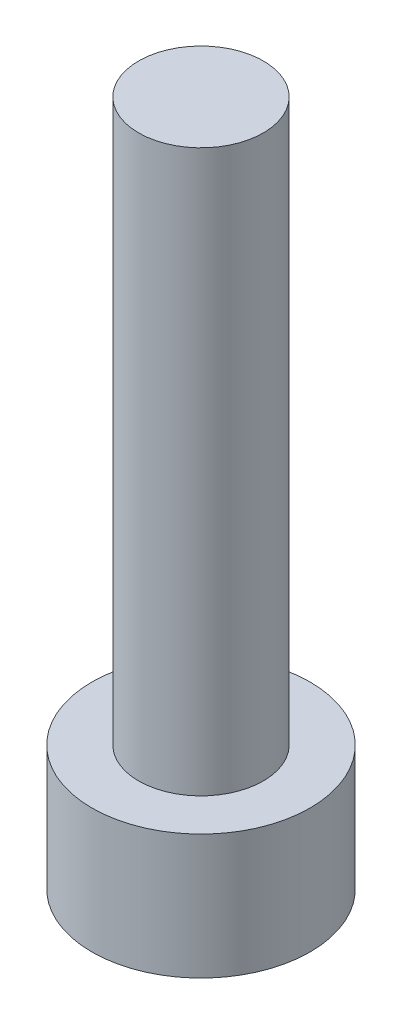
from build123d import *

# Parameters (mm, degrees)
SKETCH_1_R          = 3.5
EXTRUDE_1_DEPTH     = 4
SKETCH_2_R          = 2
EXTRUDE_2_DEPTH     = 18
CUT_EXTRUDE_1_DEPTH = 1.5


with BuildPart() as part:
    # 草图1 → 凸台-拉伸1 (new body)
    with BuildSketch(Plane(origin=(0, 0, 0), x_dir=(1, 0, 0), z_dir=(0, 1, 0))):
        Circle(SKETCH_1_R)
    extrude(amount=EXTRUDE_1_DEPTH)

    # 草图2 → 凸台-拉伸2 (add)
    with BuildSketch(Plane(origin=(0, 4, 0), x_dir=(1, 0, 0), z_dir=(0, 1, 0))):
        Circle(SKETCH_2_R)
    extrude(amount=EXTRUDE_2_DEPTH)

    # 草图3 → 切除-拉伸1 (cut)
    with BuildSketch(Plane.XZ):
        Polygon((1.271315405, -1.17633207), (1.654391159, 0.512825402), (0.383075754, 1.689157473), (-1.271315405, 1.17633207), (-1.654391159, -0.512825402), (-0.383075754, -1.689157473), align=None)
    extrude(amount=-CUT_EXTRUDE_1_DEPTH, mode=Mode.SUBTRACT)


solid = part.part
